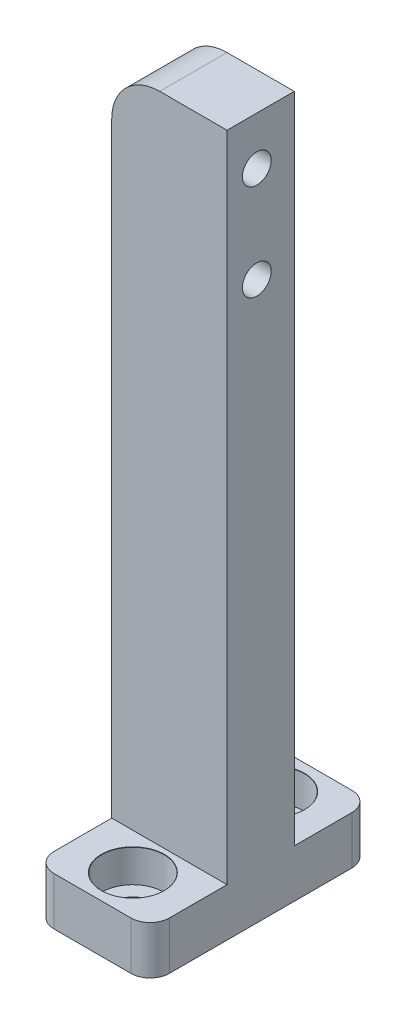
from build123d import *

# Parameters (mm, degrees)
SKETCH1_W           = 12
SKETCH1_H           = 7
BOSS_EXTRUDE1_DEPTH = 36.5
SKETCH3_W           = 12
SKETCH3_H           = 5
BOSS_EXTRUDE2_DEPTH = 11.5
FILLET1_R           = 2
FILLET2_R           = 5
CUT_EXTRUDE1_REACH  = 42.106
SKETCH7_R           = 1.5


with BuildPart() as part:
    # Sketch1 → Boss-Extrude1 (new, symmetric)
    with BuildSketch(Plane(origin=(0, 0, 0), x_dir=(1, 0, 0), z_dir=(0, 1, 0))):
        Rectangle(SKETCH1_W, SKETCH1_H)
    extrude(amount=BOSS_EXTRUDE1_DEPTH, both=True)

    # Sketch3 → Boss-Extrude2 (add, symmetric)
    with BuildSketch(Plane.XY):
        with Locations((0, -34)):
            Rectangle(SKETCH3_W, SKETCH3_H)
    extrude(amount=BOSS_EXTRUDE2_DEPTH, both=True)

    # Fillet1
    fillet1_edges = [part.edges().sort_by_distance(p)[0] for p in [
        (-6, -34, -11.5),
        (6, -34, -11.5),
        (-6, -34, 11.5),
        (6, -34, 11.5),
    ]]
    fillet(fillet1_edges, radius=FILLET1_R)

    # Sketch6 → CBORE for M3 Hex Socket Head Cap Screw1 (revolve, cut)
    with BuildSketch(Plane(origin=(0, -31.5, -7.3), x_dir=(0, 0, 1), z_dir=(1, 0, 0))):
        Polygon((0, 0), (0, 5), (1.7, 5), (1.7, 3.4), (3.25, 3.4), (3.25, 0.025), (3.275, 0), align=None)
    cbore_for_m3_hex_socket_head_cap_screw1 = revolve(axis=Axis((0, -25.15, -7.3), (0, -1, 0)), mode=Mode.SUBTRACT)

    # Mirror1: CBORE for M3 Hex Socket Head Cap Screw1 across plane
    add(cbore_for_m3_hex_socket_head_cap_screw1.mirror(Plane.XY), mode=Mode.SUBTRACT)

    # Fillet2
    fillet2_edges = [part.edges().sort_by_distance(p)[0] for p in [
        (-6, 36.5, 0),
    ]]
    fillet(fillet2_edges, radius=FILLET2_R)

    # Sketch7 → Cut-Extrude1 (cut, up to next)
    with BuildSketch(Plane(origin=(6, 0, 0), x_dir=(0, 0, -1), z_dir=(1, 0, 0)), mode=Mode.PRIVATE) as cut_extrude1_sk1:
        with Locations((-0.4, 31.5)):
            Circle(SKETCH7_R)
    cut_extrude1_tool1 = extrude(cut_extrude1_sk1.sketch, amount=-CUT_EXTRUDE1_REACH, mode=Mode.PRIVATE) & part.part
    # Sketch7 → Cut-Extrude1 (cut, up to next)
    with BuildSketch(Plane(origin=(6, 0, 0), x_dir=(0, 0, -1), z_dir=(1, 0, 0)), mode=Mode.PRIVATE) as cut_extrude1_sk2:
        with Locations((-0.4, 21.5)):
            Circle(SKETCH7_R)
    cut_extrude1_tool2 = extrude(cut_extrude1_sk2.sketch, amount=-CUT_EXTRUDE1_REACH, mode=Mode.PRIVATE) & part.part
    add(cut_extrude1_tool1.solids().sort_by_distance((6, 31.5, 0.4))[0], mode=Mode.SUBTRACT)
    add(cut_extrude1_tool2.solids().sort_by_distance((6, 21.5, 0.4))[0], mode=Mode.SUBTRACT)


solid = part.part
